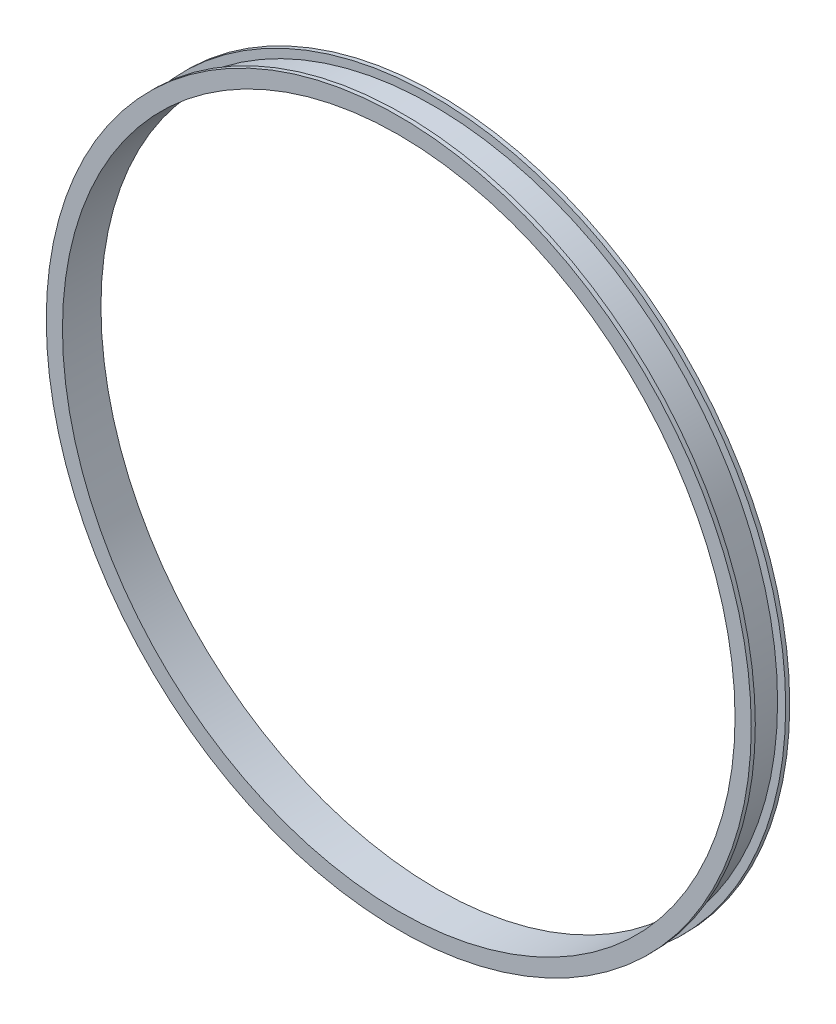
from build123d import *

# Parameters (mm, degrees)
SKETCH1_R   = 85
SKETCH1_R_2 = 83
TRACK_DEPTH = 3.75
SKETCH2_R   = 87
SKETCH2_R_2 = 83
RAIL_DEPTH  = 1


with BuildPart() as part:
    # Sketch1 → Track (new, symmetric)
    with BuildSketch(Plane.XY):
        Circle(SKETCH1_R)
        Circle(SKETCH1_R_2, mode=Mode.SUBTRACT)
    extrude(amount=TRACK_DEPTH, both=True)

    # Sketch2 → Rail (add)
    with BuildSketch(Plane.XY.offset(3.75)):
        Circle(SKETCH2_R)
        Circle(SKETCH2_R_2, mode=Mode.SUBTRACT)
    rail = extrude(amount=RAIL_DEPTH)

    # Mirror1: Rail across plane
    add(rail.mirror(Plane.XY))


solid = part.part
